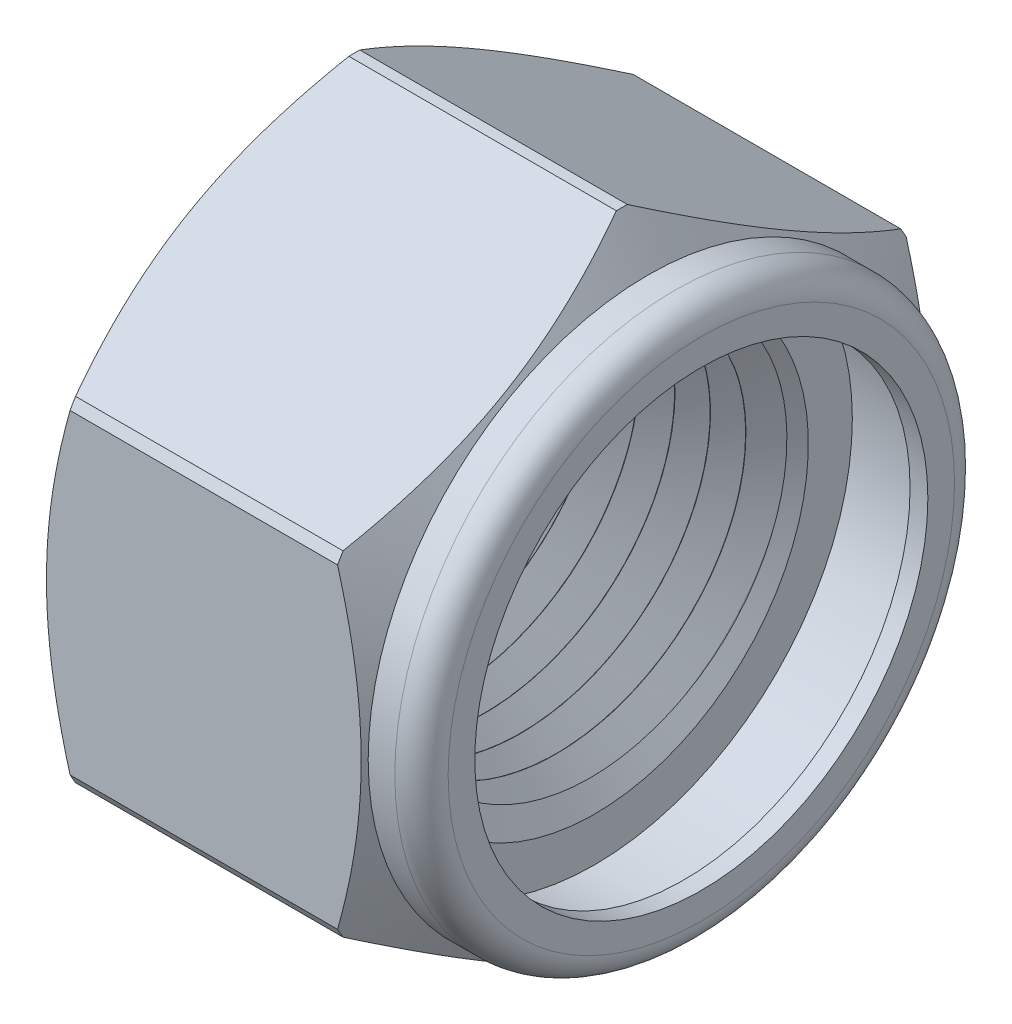
from build123d import *

# Parameters (mm, degrees)
BOSS_EXTRUDE1_DEPTH = 23
SKETCH2_OUTSIDE_W   = 44.804
SKETCH2_OUTSIDE_H   = 49.754
SKETCH2_OUTSIDE_R   = 18.3
CUT_EXTRUDE2_DEPTH  = 23
SKETCH3_OUTSIDE_W   = 44.756
SKETCH3_OUTSIDE_H   = 49.356
SKETCH3_OUTSIDE_R   = 15.75
CUT_EXTRUDE6_DEPTH  = 5
SKETCH4_R           = 14.5
CUT_EXTRUDE7_DEPTH  = 8
SKETCH8_R           = 15.75
CUT_EXTRUDE9_DEPTH  = 3
EXTRUDE_THIN1_START = -2
SKETCH8_3_R         = 15.75
SKETCH8_3_R_2       = 12.75
EXTRUDE_THIN1_DEPTH = 1
FILLET1_R           = 1.5
FILLET2_R           = 0.5
CUT_SWEEP1_PITCH    = 2


with BuildPart() as part:
    # Sketch1 → Boss-Extrude1 (new body)
    with BuildSketch(Plane(origin=(0, 0, 0), x_dir=(0, 0, -1), z_dir=(1, 0, 0))):
        Polygon((16, -9.237604307), (16, 9.237604307), (0, 18.475208614), (-16, 9.237604307), (-16, -9.237604307), (0, -18.475208614), align=None)
    extrude(amount=BOSS_EXTRUDE1_DEPTH)

    # Sketch2 outside → Cut-Extrude2 (cut)
    with BuildSketch(Plane(origin=(23, 0, 0), x_dir=(0, 0, -1), z_dir=(1, 0, 0))):
        Rectangle(SKETCH2_OUTSIDE_W, SKETCH2_OUTSIDE_H)
        Circle(SKETCH2_OUTSIDE_R, mode=Mode.SUBTRACT)
    extrude(amount=-CUT_EXTRUDE2_DEPTH, mode=Mode.SUBTRACT)

    # Sketch3 outside → Cut-Extrude6 (cut)
    with BuildSketch(Plane(origin=(23, 0, 0), x_dir=(0, 0, -1), z_dir=(1, 0, 0))):
        Rectangle(SKETCH3_OUTSIDE_W, SKETCH3_OUTSIDE_H)
        Circle(SKETCH3_OUTSIDE_R, mode=Mode.SUBTRACT)
    extrude(amount=-CUT_EXTRUDE6_DEPTH, mode=Mode.SUBTRACT)

    # Sketch4 → Cut-Extrude7 (cut)
    with BuildSketch(Plane(origin=(23, 0, 0), x_dir=(0, 0, -1), z_dir=(1, 0, 0))):
        Circle(SKETCH4_R)
    extrude(amount=-CUT_EXTRUDE7_DEPTH, mode=Mode.SUBTRACT)

    # Sketch6 → M24 Tapped Hole1 (revolve, cut)
    with BuildSketch(Plane.ZX):
        Polygon((0, 0), (0, 15), (12.025, 15), (10.5, 14.119540839), (10.5, 0.880459161), (12.025, 0), align=None)
    revolve(axis=Axis((-6.35, 0, 0), (1, 0, 0)), mode=Mode.SUBTRACT)

    # Sketch7 → Cut-Revolve1 (revolve, cut)
    with BuildSketch(Plane.XY, mode=Mode.PRIVATE) as cut_revolve1_sk:
        Polygon((18, 15.75), (18, 20.2974086), (15.374552421, 20.2974086), align=None)
        Polygon((2.625447579, 20.2974086), (0, 15.75), (0, 20.2974086), align=None)
    revolve(cut_revolve1_sk.sketch.rotate(Axis((9, 0, 0), (1, 0, 0)), 180), axis=Axis((9, 0, 0), (1, 0, 0)), mode=Mode.SUBTRACT)

    # Sketch8 → Cut-Extrude9 (cut)
    with BuildSketch(Plane(origin=(23, 0, 0), x_dir=(0, 0, -1), z_dir=(1, 0, 0))):
        Circle(SKETCH8_R)
    extrude(amount=-CUT_EXTRUDE9_DEPTH, mode=Mode.SUBTRACT)

    # Sketch8<3> → Extrude-Thin1 (add)
    with BuildSketch(Plane(origin=(23, 0, 0), x_dir=(0, 0, -1), z_dir=(1, 0, 0)).offset(EXTRUDE_THIN1_START)):
        Circle(SKETCH8_3_R)
        Circle(SKETCH8_3_R_2, mode=Mode.SUBTRACT)
    extrude(amount=-EXTRUDE_THIN1_DEPTH)

    # Fillet1
    fillet1_edges = [part.edges().sort_by_distance(p)[0] for p in [
        (21, 0, 15.75),
    ]]
    fillet(fillet1_edges, radius=FILLET1_R)

    # Fillet2
    fillet2_edges = [part.edges().sort_by_distance(p)[0] for p in [
        (20, 0, 14.5),
    ]]
    fillet(fillet2_edges, radius=FILLET2_R)

    # Cut-Sweep1: the profile of Sketch13 screwed along a right-hand helix of 10 turns, 10 arcs to a turn; built about Z, then put on its axis
    cut_sweep1_z = Axis((0, 0, 0), (0, 0, 1))
    cut_sweep1_corners = [(12.066025404, 0, 0.08660254), (10.216025404, 0, 1.154700538), (10.216025404, 0, -1.154700538), (12.066025404, 0, -0.08660254), (12.116025404, 0, 0)]
    with BuildLine(mode=Mode.PRIVATE) as cut_sweep1_profile:
        Line(cut_sweep1_corners[0], cut_sweep1_corners[1])
        Line(cut_sweep1_corners[1], cut_sweep1_corners[2])
        Line(cut_sweep1_corners[2], cut_sweep1_corners[3])
        ThreePointArc((12.066025404, 0, -0.08660254), (12.102627944, 0, -0.05), (12.116025404, 0, 0))
        ThreePointArc((12.116025404, 0, 0), (12.102627944, 0, 0.05), (12.066025404, 0, 0.08660254))
    cut_sweep1_cap = Face(cut_sweep1_profile.wire())
    cut_sweep1_arcs = [((12.066025404, 0, -0.08660254), (12.116025404, 0, -0.057735027), (12.116025404, 0, 0), (1, 0.8660254037844373, 1)), ((12.116025404, 0, 0), (12.116025404, 0, 0.057735027), (12.066025404, 0, 0.08660254), (1, 0.8660254037844373, 1))]  # start, shoulder, end, weights
    cut_sweep1_turn_angles = [0, 18, 36, 54, 72, 90, 108, 126, 144, 162, 180, 198, 216, 234, 252, 270, 288, 306, 324, 342, 360]
    cut_sweep1_turn_weights = [1, 0.9510565162951535, 1, 0.9510565162951535, 1, 0.9510565162951535, 1, 0.9510565162951535, 1, 0.9510565162951535, 1, 0.9510565162951535, 1, 0.9510565162951535, 1, 0.9510565162951535, 1, 0.9510565162951535, 1, 0.9510565162951535, 1]
    cut_sweep1_turn_rails = [Edge.make_bspline([Vector(p[0], p[1], 0).rotate(cut_sweep1_z, cut_sweep1_turn_angles[k]) / cut_sweep1_turn_weights[k] + Vector(0, 0, p[2] + CUT_SWEEP1_PITCH * cut_sweep1_turn_angles[k] / 360) for k in range(21)], [0, 0, 0, 1, 1, 2, 2, 3, 3, 4, 4, 5, 5, 6, 6, 7, 7, 8, 8, 9, 9, 10, 10, 10], 2, cut_sweep1_turn_weights) for p in cut_sweep1_corners]
    cut_sweep1_turn_sides = [*[Face.make_surface_from_curves(cut_sweep1_turn_rails[p[0]], cut_sweep1_turn_rails[p[1]]) for p in [(0, 1), (1, 2), (2, 3)]], *[Face.make_bezier_surface([[Vector(p[j][0], p[j][1], 0).rotate(cut_sweep1_z, cut_sweep1_turn_angles[2 * i + k]) / cut_sweep1_turn_weights[2 * i + k] + Vector(0, 0, p[j][2] + CUT_SWEEP1_PITCH * cut_sweep1_turn_angles[2 * i + k] / 360) for k in range(3)] for j in range(3)], [[p[3][j] * cut_sweep1_turn_weights[2 * i + k] for k in range(3)] for j in range(3)]) for p in cut_sweep1_arcs for i in range(10)]]
    cut_sweep1 = Plane(origin=(-3, 0, 0), x_dir=(0, 0, 1), z_dir=(1, 0, 0)) * Solid(Shell([*[p.moved(Location((0, 0, CUT_SWEEP1_PITCH * i))) for i in range(10) for p in cut_sweep1_turn_sides], cut_sweep1_cap, cut_sweep1_cap.rotate(cut_sweep1_z, 3600).moved(Location((0, 0, CUT_SWEEP1_PITCH * 3600 / 360)))]))
    add(cut_sweep1, mode=Mode.SUBTRACT)


solid = part.part
